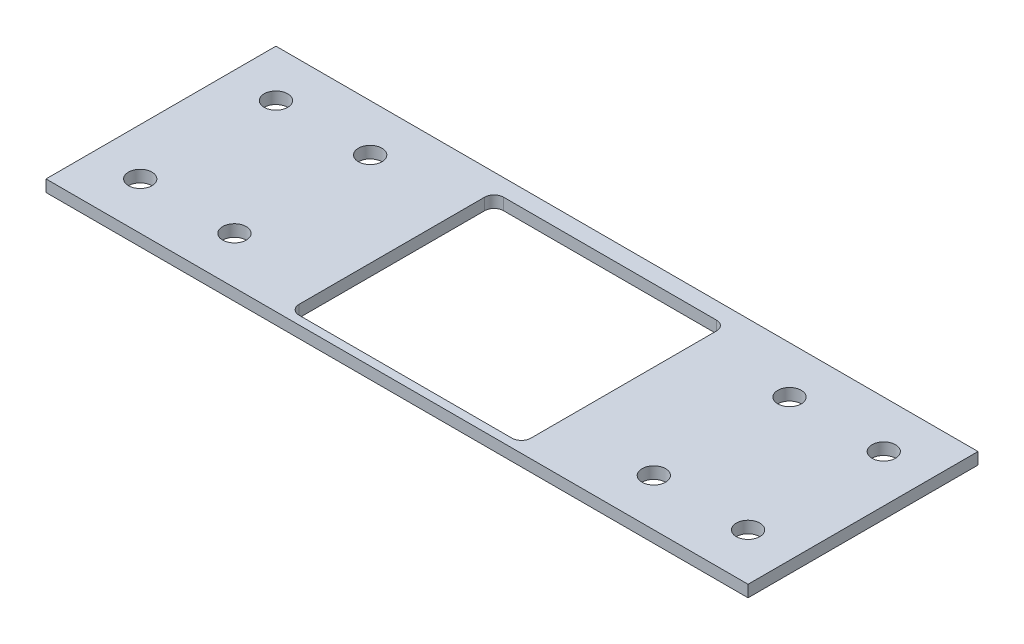
from build123d import *

# Parameters (mm, degrees)
SKETCH1_W           = 138.43
SKETCH1_H           = 61.976
BOSS_EXTRUDE1_DEPTH = 25.4
CUT_EXTRUDE1_REACH  = 146.112
SKETCH2_W           = 61.976
SKETCH2_H           = 22.225
SKETCH3_R           = 3.175
CUT_EXTRUDE2_DEPTH  = 76.901600734
SKETCH5_W           = 61.976
SKETCH5_H           = 3.175
BOSS_EXTRUDE2_DEPTH = 25.4
SKETCH7_W           = 61.976
SKETCH7_H           = 3.175
BOSS_EXTRUDE3_DEPTH = 25.4
CUT_EXTRUDE3_REACH  = 101.611
SKETCH8_R           = 3.175
SKETCH9_W           = 62.484
SKETCH9_H           = 55.118
CUT_EXTRUDE4_DEPTH  = 100.610918046
FILLET1_R           = 2.54


with BuildPart() as part:
    # Sketch1 → Boss-Extrude1 (new body)
    with BuildSketch(Plane(origin=(0, 0, 0), x_dir=(1, 0, 0), z_dir=(0, 1, 0))):
        Rectangle(SKETCH1_W, SKETCH1_H)
    extrude(amount=BOSS_EXTRUDE1_DEPTH)

    # Sketch2 → Cut-Extrude1 (cut, up to next)
    with BuildSketch(Plane.ZY.offset(69.215), mode=Mode.PRIVATE) as cut_extrude1_sk1:
        with Locations((0, 11.1125)):
            Rectangle(SKETCH2_W, SKETCH2_H)
    cut_extrude1_tool1 = extrude(cut_extrude1_sk1.sketch, amount=-CUT_EXTRUDE1_REACH, mode=Mode.PRIVATE) & part.part
    add(cut_extrude1_tool1.solids().sort_by_distance((-69.215, 11.1125, 0))[0], mode=Mode.SUBTRACT)

    # Sketch3 → Cut-Extrude2 (cut, through all)
    with BuildSketch(Plane(origin=(0, 25.4, 0), x_dir=(1, 0, 0), z_dir=(0, 1, 0))):
        with Locations((-56.515, 18.288)):
            Circle(SKETCH3_R)
        with Locations((-56.515, -18.288)):
            Circle(SKETCH3_R)
        with Locations((56.515, -18.288)):
            Circle(SKETCH3_R)
        with Locations((56.515, 18.288)):
            Circle(SKETCH3_R)
    extrude(amount=-CUT_EXTRUDE2_DEPTH, mode=Mode.SUBTRACT)

    # Sketch5 → Boss-Extrude2 (add)
    with BuildSketch(Plane.ZY.offset(69.215)):
        with Locations((0, 23.8125)):
            Rectangle(SKETCH5_W, SKETCH5_H)
    extrude(amount=BOSS_EXTRUDE2_DEPTH)

    # Sketch7 → Boss-Extrude3 (add)
    with BuildSketch(Plane(origin=(69.215, 0, 0), x_dir=(0, 0, -1), z_dir=(1, 0, 0))):
        with Locations((0, 23.8125)):
            Rectangle(SKETCH7_W, SKETCH7_H)
    extrude(amount=BOSS_EXTRUDE3_DEPTH)

    # Sketch8 → Cut-Extrude3 (cut, up to next)
    with BuildSketch(Plane(origin=(0, 25.4, 0), x_dir=(1, 0, 0), z_dir=(0, 1, 0)), mode=Mode.PRIVATE) as cut_extrude3_sk1:
        with Locations((-81.915, 18.288)):
            Circle(SKETCH8_R)
    cut_extrude3_tool1 = extrude(cut_extrude3_sk1.sketch, amount=-CUT_EXTRUDE3_REACH, mode=Mode.PRIVATE) & part.part
    # Sketch8 → Cut-Extrude3 (cut, up to next)
    with BuildSketch(Plane(origin=(0, 25.4, 0), x_dir=(1, 0, 0), z_dir=(0, 1, 0)), mode=Mode.PRIVATE) as cut_extrude3_sk2:
        with Locations((-81.915, -18.288)):
            Circle(SKETCH8_R)
    cut_extrude3_tool2 = extrude(cut_extrude3_sk2.sketch, amount=-CUT_EXTRUDE3_REACH, mode=Mode.PRIVATE) & part.part
    # Sketch8 → Cut-Extrude3 (cut, up to next)
    with BuildSketch(Plane(origin=(0, 25.4, 0), x_dir=(1, 0, 0), z_dir=(0, 1, 0)), mode=Mode.PRIVATE) as cut_extrude3_sk3:
        with Locations((81.915, -18.288)):
            Circle(SKETCH8_R)
    cut_extrude3_tool3 = extrude(cut_extrude3_sk3.sketch, amount=-CUT_EXTRUDE3_REACH, mode=Mode.PRIVATE) & part.part
    # Sketch8 → Cut-Extrude3 (cut, up to next)
    with BuildSketch(Plane(origin=(0, 25.4, 0), x_dir=(1, 0, 0), z_dir=(0, 1, 0)), mode=Mode.PRIVATE) as cut_extrude3_sk4:
        with Locations((81.915, 18.288)):
            Circle(SKETCH8_R)
    cut_extrude3_tool4 = extrude(cut_extrude3_sk4.sketch, amount=-CUT_EXTRUDE3_REACH, mode=Mode.PRIVATE) & part.part
    add(cut_extrude3_tool1.solids().sort_by_distance((-81.915, 25.4, -18.288))[0], mode=Mode.SUBTRACT)
    add(cut_extrude3_tool2.solids().sort_by_distance((-81.915, 25.4, 18.288))[0], mode=Mode.SUBTRACT)
    add(cut_extrude3_tool3.solids().sort_by_distance((81.915, 25.4, 18.288))[0], mode=Mode.SUBTRACT)
    add(cut_extrude3_tool4.solids().sort_by_distance((81.915, 25.4, -18.288))[0], mode=Mode.SUBTRACT)

    # Sketch9 → Cut-Extrude4 (cut, through all)
    with BuildSketch(Plane(origin=(0, 25.4, 0), x_dir=(1, 0, 0), z_dir=(0, 1, 0))):
        with Locations((0, -1.143)):
            Rectangle(SKETCH9_W, SKETCH9_H)
    extrude(amount=-CUT_EXTRUDE4_DEPTH, mode=Mode.SUBTRACT)

    # Fillet1
    fillet1_edges = [part.edges().sort_by_distance(p)[0] for p in [
        (31.242, 23.8125, 28.702),
        (-31.242, 23.8125, 28.702),
        (31.242, 23.8125, -26.416),
        (-31.242, 23.8125, -26.416),
    ]]
    fillet(fillet1_edges, radius=FILLET1_R)


solid = part.part
